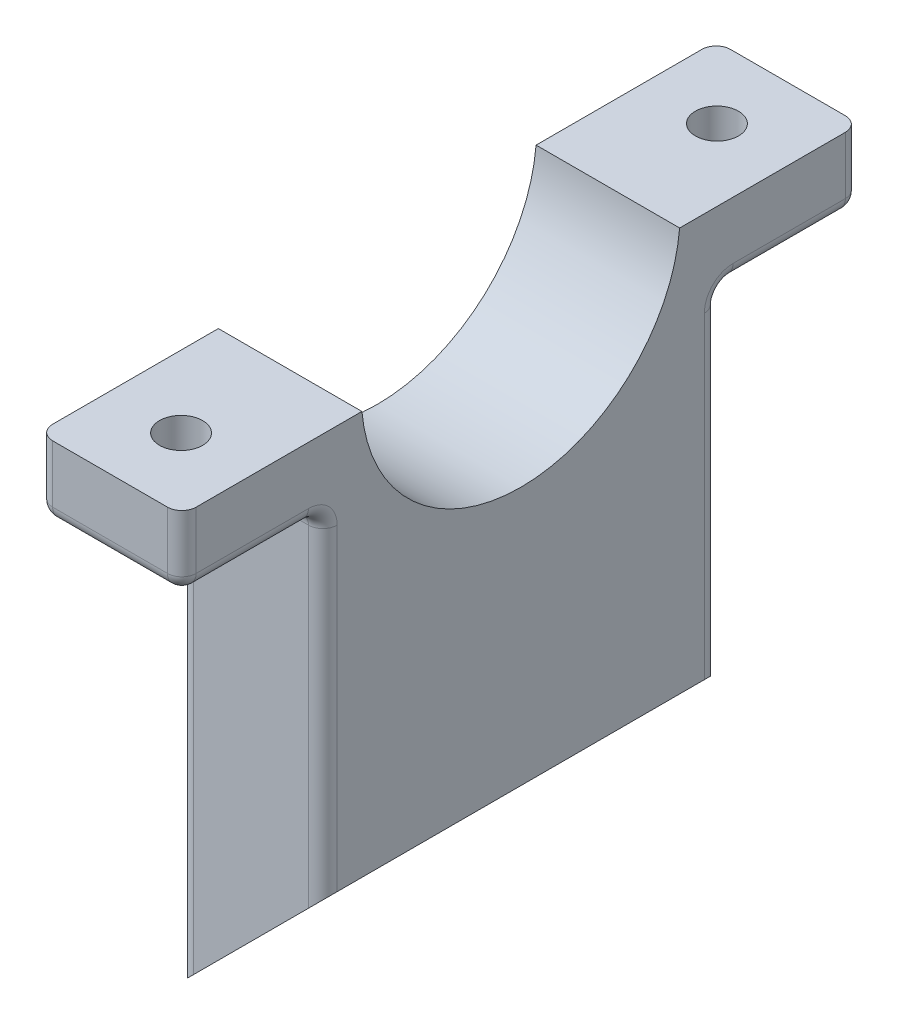
from build123d import *

# Parameters (mm, degrees)
CLAMP_EXTRUDE_DEPTH = 10
CUT_EXTRUDE3_DEPTH  = 56.03390543
FILLET2_R           = 1
FILLET3_R           = 1
CUT_EXTRUDE4_DEPTH  = 2.2
HOLE_5_R            = 1.5
CUT_EXTRUDE5_DEPTH  = 42.880637682


with BuildPart() as part:
    # Sketch4 → Clamp Extrude (new body)
    with BuildSketch(Plane(origin=(0, 0, 0), x_dir=(0, 0, -1), z_dir=(1, 0, 0))):
        with BuildLine():
            Line((-23.612500003, -1), (-23.612500003, -6))
            Line((-23.612500003, -6), (-13.789947652, -6))
            Line((-13.789947652, -6), (-13.789947652, -39.1125))
            Line((-13.789947652, -39.1125), (13.789947652, -39.1125))
            Line((13.789947652, -39.1125), (13.789947652, -6))
            Line((13.789947652, -6), (23.612500003, -6))
            Line((23.612500003, -6), (23.612500003, -1))
            Line((23.612500003, -1), (11.067414163, -1))
            ThreePointArc((11.067414163, -1), (0, -11.1125), (-11.067414163, -1))
            Line((-11.067414163, -1), (-23.612500003, -1))
        make_face()
    extrude(amount=CLAMP_EXTRUDE_DEPTH)

    # Sketch10 → Cut-Extrude3 (cut, through all)
    with BuildSketch(Plane(origin=(0, 0, -13.789947652), x_dir=(-1, 0, 0), z_dir=(0, 0, -1))):
        Polygon((0, -39.1125), (-10, -29.1125), (-10, -39.1125), align=None)
    extrude(amount=-CUT_EXTRUDE3_DEPTH, mode=Mode.SUBTRACT)

    # Fillet2
    fillet2_edges = [part.edges().sort_by_distance(p)[0] for p in [
        (0, -6, 18.701223827),
        (0, -6, -18.701223827),
        (0, -22.55625, -13.789947652),
        (0, -22.55625, 13.789947652),
        (10, -6, -18.701223827),
        (5, -6, 13.789947652),
        (5, -6, 23.612500003),
        (5, -6, -23.612500003),
        (5, -6, -13.789947652),
        (10, -17.55625, -13.789947652),
        (10, -6, 18.701223827),
        (10, -17.55625, 13.789947652),
    ]]
    fillet(fillet2_edges, radius=FILLET2_R)

    # Fillet3
    # the kernel refuses this fillet: 1 mm, written as the material it takes off along each edge
    with BuildSketch(Plane(origin=(1, -5, 22.612500003), x_dir=(-1, 0, 0), z_dir=(0, 0, 1))) as fillet3_piece_1_section:
        Polygon((0, 0), (FILLET3_R, 0), (FILLET3_R, FILLET3_R), (0, FILLET3_R), align=None)
    fillet3_piece_1 = extrude(amount=FILLET3_R, mode=Mode.PRIVATE)
    fillet3_piece_1 = fillet3_piece_1 - Plane(origin=(1, -5, 22.612500003), x_dir=(0.7071067811865475, 0.7071067811865475, 0), z_dir=(0, 0, 1)) * Sphere(FILLET3_R, mode=Mode.PRIVATE)
    add(fillet3_piece_1, mode=Mode.SUBTRACT)
    with BuildSketch(Plane(origin=(9, -5, 22.612500003), x_dir=(1, 0, 0), z_dir=(0, 0, 1))) as fillet3_piece_2_section:
        Polygon((0, 0), (FILLET3_R, 0), (FILLET3_R, -FILLET3_R), (0, -FILLET3_R), align=None)
    fillet3_piece_2 = extrude(amount=FILLET3_R, mode=Mode.PRIVATE)
    fillet3_piece_2 = fillet3_piece_2 - Plane(origin=(9, -5, 22.612500003), x_dir=(-0.7071067811865475, 0.7071067811865475, 0), z_dir=(0, 0, 1)) * Sphere(FILLET3_R, mode=Mode.PRIVATE)
    add(fillet3_piece_2, mode=Mode.SUBTRACT)
    with BuildSketch(Plane(origin=(9, -5, -22.612500003), x_dir=(0, 0, -1), z_dir=(1, 0, 0))) as fillet3_piece_3_section:
        Polygon((0, 0), (FILLET3_R, 0), (FILLET3_R, -FILLET3_R), (0, -FILLET3_R), align=None)
    fillet3_piece_3 = extrude(amount=FILLET3_R, mode=Mode.PRIVATE)
    fillet3_piece_3 = fillet3_piece_3 - Plane(origin=(9, -5, -22.612500003), x_dir=(0, 0.7071067811865475, 0.7071067811865475), z_dir=(1, 0, 0)) * Sphere(FILLET3_R, mode=Mode.PRIVATE)
    add(fillet3_piece_3, mode=Mode.SUBTRACT)
    with BuildSketch(Plane(origin=(1, -5, -22.612500003), x_dir=(0, 0, -1), z_dir=(-1, 0, 0))) as fillet3_piece_4_section:
        Polygon((0, 0), (FILLET3_R, 0), (FILLET3_R, FILLET3_R), (0, FILLET3_R), align=None)
    fillet3_piece_4 = extrude(amount=FILLET3_R, mode=Mode.PRIVATE)
    fillet3_piece_4 = fillet3_piece_4 - Plane(origin=(1, -5, -22.612500003), x_dir=(0, 0.7071067811865475, 0.7071067811865475), z_dir=(-1, 0, 0)) * Sphere(FILLET3_R, mode=Mode.PRIVATE)
    add(fillet3_piece_4, mode=Mode.SUBTRACT)
    with BuildSketch(Plane(origin=(0, 1.5, 23.612500003), x_dir=(1, 0, 0), z_dir=(0, -1, 0)), Plane(origin=(10, -5, -23.612500003), x_dir=(0, 0, 1), z_dir=(0, 1, 0))) as fillet3_piece_5:
        with BuildLine():
            CenterArc((FILLET3_R, -FILLET3_R), FILLET3_R, 90, 90)
            Line((0, -FILLET3_R), (0, 0))
            Line((0, 0), (FILLET3_R, 0))
        make_face()
    extrude(amount=6.5, mode=Mode.SUBTRACT)
    with BuildSketch(Plane(origin=(10, 1.5, 23.612500003), x_dir=(-1, 0, 0), z_dir=(0, -1, 0)), Plane(origin=(0, -5, -23.612500003), x_dir=(0, 0, 1), z_dir=(0, 1, 0))) as fillet3_piece_6:
        with BuildLine():
            CenterArc((FILLET3_R, FILLET3_R), FILLET3_R, 180, 90)
            Line((0, FILLET3_R), (0, 0))
            Line((0, 0), (FILLET3_R, 0))
        make_face()
    extrude(amount=6.5, mode=Mode.SUBTRACT)

    # Hole → Cut-Extrude4 (cut)
    with BuildSketch(Plane.XZ.offset(6)):
        Polygon((8.319764048, 18.664947652), (6.659882024, 21.539947652), (3.340117976, 21.539947652), (1.680235952, 18.664947652), (3.340117976, 15.789947652), (6.659882024, 15.789947652), align=None)
        Polygon((6.659882024, -15.789947652), (8.319764048, -18.664947652), (6.659882024, -21.539947652), (3.340117976, -21.539947652), (1.680235952, -18.664947652), (3.340117976, -15.789947652), align=None)
    extrude(amount=-CUT_EXTRUDE4_DEPTH, mode=Mode.SUBTRACT)

    # Hole<5> → Cut-Extrude5 (cut, through all)
    with BuildSketch(Plane.XZ.offset(6)):
        with Locations(Location((5, 18.664947652, 0), (0, 0, 270))):
            Circle(HOLE_5_R)
        with Locations(Location((5, -18.664947652, 0), (0, 0, 90))):
            Circle(HOLE_5_R)
    extrude(amount=-CUT_EXTRUDE5_DEPTH, mode=Mode.SUBTRACT)


solid = part.part
